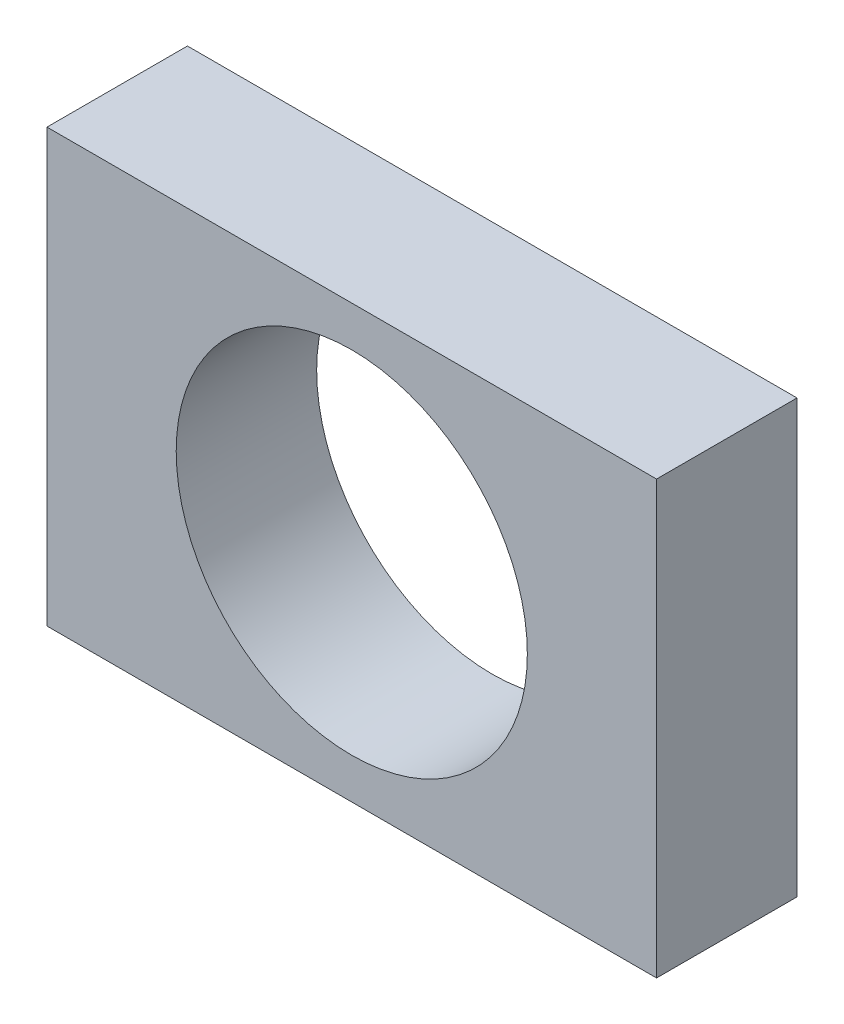
from build123d import *

# Parameters (mm, degrees)
SKETCH1_W           = 110.237040332
SKETCH1_H           = 78.14500721
BOSS_EXTRUDE1_DEPTH = 25.4
SKETCH2_R           = 31.75
CUT_EXTRUDE1_DEPTH  = 73.179441694


with BuildPart() as part:
    # Sketch1 → Boss-Extrude1 (new body)
    with BuildSketch(Plane.XY):
        Rectangle(SKETCH1_W, SKETCH1_H)
    extrude(amount=-BOSS_EXTRUDE1_DEPTH)

    # Sketch2 → Cut-Extrude1 (cut, through all)
    with BuildSketch(Plane.XY):
        Circle(SKETCH2_R)
    extrude(amount=-CUT_EXTRUDE1_DEPTH, mode=Mode.SUBTRACT)


solid = part.part
